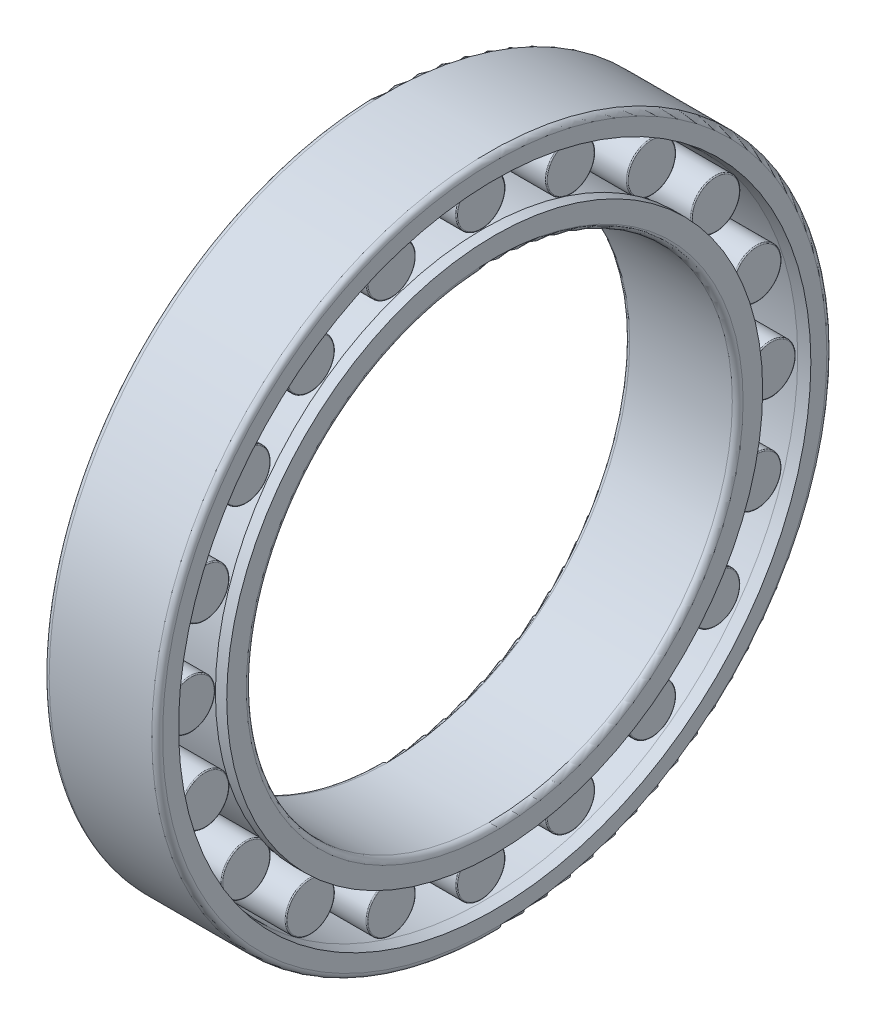
from build123d import *

# Parameters (mm, degrees)
ROLLERSDETAILED_COUNT = 20
ROLLERSDETAILED_ANGLE = 342


with BuildPart() as part:
    # OutRacSke → OuterRace (revolve)
    with BuildSketch(Plane.XY):
        with BuildLine():
            Line((16.8, 116.42), (21, 117.086666667))
            Line((21, 117.086666667), (21, 123))
            ThreePointArc((21, 123), (20.414213562, 124.414213562), (19, 125))
            Line((19, 125), (-19, 125))
            ThreePointArc((-19, 125), (-20.414213562, 124.414213562), (-21, 123))
            Line((-21, 123), (-21, 117.086666667))
            Line((-21, 117.086666667), (-16.8, 116.42))
            Line((-16.8, 116.42), (16.8, 116.42))
        make_face()
    revolve(axis=Axis((-90, 0, 0), (1, 0, 0)))

    # RolDetSke → RollerDetailed (revolve)
    with BuildSketch(Plane.XY):
        with BuildLine():
            Line((-15.96, 116.18512), (-15.96, 107.5))
            Line((-15.96, 107.5), (15.96, 107.5))
            Line((15.96, 107.5), (15.96, 116.18512))
            ThreePointArc((15.96, 116.18512), (15.854007802, 116.441007802), (15.59812, 116.547))
            Line((15.59812, 116.547), (-15.59812, 116.547))
            ThreePointArc((-15.59812, 116.547), (-15.854007802, 116.441007802), (-15.96, 116.18512))
        make_face()
    rollerdetailed = revolve(axis=Axis((-33.6, 107.5, 0), (1, 0, 0)))

    # InsRacSke → InnerRace (revolve)
    with BuildSketch(Plane.XY):
        with BuildLine():
            Line((16.8, 98.58), (16.8, 99.246666667))
            Line((16.8, 99.246666667), (21, 99.246666667))
            Line((21, 99.246666667), (21, 92))
            ThreePointArc((21, 92), (20.414213562, 90.585786438), (19, 90))
            Line((19, 90), (-19, 90))
            ThreePointArc((-19, 90), (-20.414213562, 90.585786438), (-21, 92))
            Line((-21, 92), (-21, 99.246666667))
            Line((-21, 99.246666667), (-16.8, 99.246666667))
            Line((-16.8, 99.246666667), (-16.8, 98.58))
            Line((-16.8, 98.58), (16.8, 98.58))
        make_face()
    revolve(axis=Axis((-90, 0, 0), (1, 0, 0)))

    # RollersDetailed: RollerDetailed ×20 about axis
    rollersdetailed_axis = Axis((-50, 0, 0), (1, 0, 0))
    for i in range(1, ROLLERSDETAILED_COUNT):
        add(rollerdetailed.rotate(rollersdetailed_axis, i * ROLLERSDETAILED_ANGLE / (ROLLERSDETAILED_COUNT - 1)))


solid = part.part
